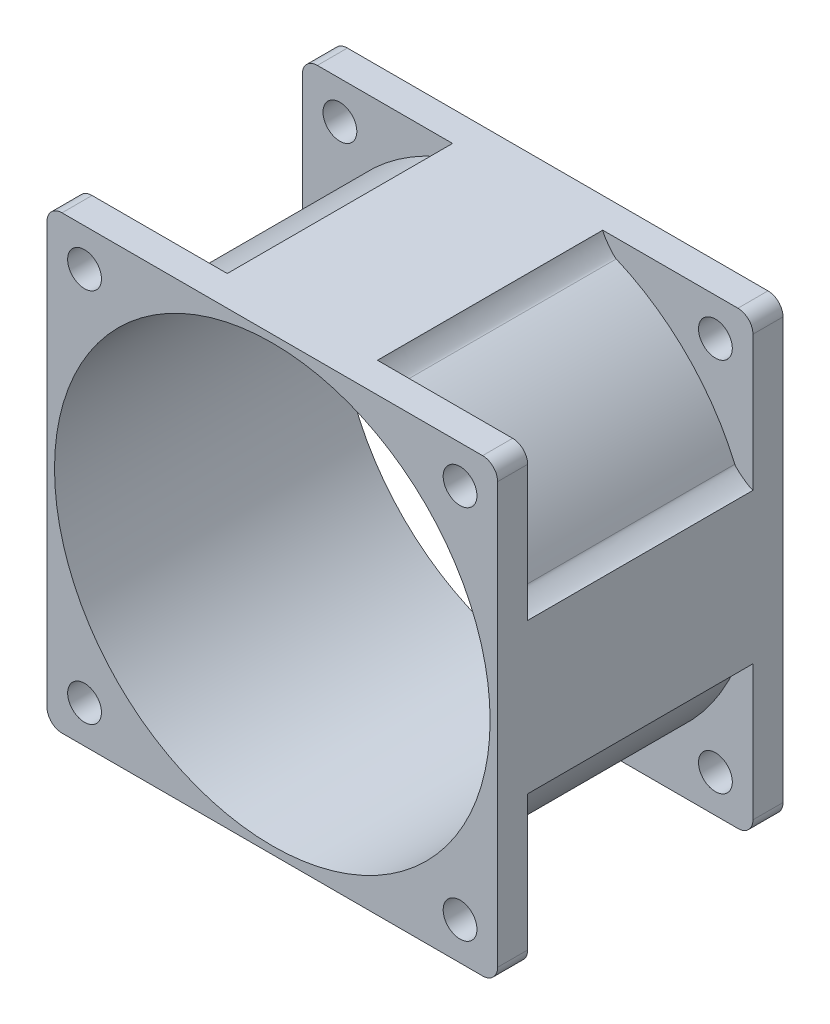
from build123d import *

# Parameters (mm, degrees)
SKETCH7_W           = 60
SKETCH7_H           = 60
BOSS_EXTRUDE1_DEPTH = 30
SKETCH8_OUTSIDE_W   = 80
SKETCH8_OUTSIDE_H   = 80
CUT_EXTRUDE1_DEPTH  = 30
FILLET3_DEPTH       = 30
SKETCH6_W           = 60
SKETCH6_H           = 60
SKETCH6_R           = 2.25
BOSS_EXTRUDE2_DEPTH = 4
BOSS_EXTRUDE3_START = 34
SKETCH9_W           = 60
SKETCH9_H           = 60
SKETCH9_R           = 2.25
BOSS_EXTRUDE3_DEPTH = 4
SKETCH11_R          = 29
CUT_EXTRUDE3_DEPTH  = 50
FILLET4_R           = 2


with BuildPart() as part:
    # Sketch7 → Boss-Extrude1 (new body)
    with BuildSketch(Plane.XY):
        Rectangle(SKETCH7_W, SKETCH7_H)
    extrude(amount=BOSS_EXTRUDE1_DEPTH)

    # Sketch8 outside → Cut-Extrude1 (cut)
    with BuildSketch(Plane.XY.offset(30)):
        Rectangle(SKETCH8_OUTSIDE_W, SKETCH8_OUTSIDE_H)
        with BuildLine():
            Line((10, 30), (-10, 30))
            Line((-10, 30), (-10, 28.284271247))
            ThreePointArc((-10, 28.284271247), (-21.213203436, 21.213203436), (-28.284271247, 10))
            Line((-28.284271247, 10), (-30, 10))
            Line((-30, 10), (-30, -10))
            Line((-30, -10), (-28.284271247, -10))
            ThreePointArc((-28.284271247, -10), (-21.213203436, -21.213203436), (-10, -28.284271247))
            Line((-10, -28.284271247), (-10, -30))
            Line((-10, -30), (10, -30))
            Line((10, -30), (10, -28.284271247))
            ThreePointArc((10, -28.284271247), (21.213203436, -21.213203436), (28.284271247, -10))
            Line((28.284271247, -10), (30, -10))
            Line((30, -10), (30, 10))
            Line((30, 10), (28.284271247, 10))
            ThreePointArc((28.284271247, 10), (21.213203436, 21.213203436), (10, 28.284271247))
            Line((10, 28.284271247), (10, 30))
        make_face(mode=Mode.SUBTRACT)
    extrude(amount=-CUT_EXTRUDE1_DEPTH, mode=Mode.SUBTRACT)

    # Fillet3: read off the stored shape, not the designer's step
    # Fillet3 outline → Fillet3 (add)
    with BuildSketch(Plane.XY):
        with BuildLine():
            ThreePointArc((-28.284271247, 10), (-27.947444484, 10.905977573), (-27.581606794, 11.800634164))
            add(Edge.make_bspline(
                [(-27.581606794, 11.800634164), (-28.267504723, 10.197485832), (-30, 10)],
                knots=[0, 0, 0, 1, 1, 1], degree=2, weights=[1, 0.259369866, 1]))
            Line((-30, 10), (-28.284271247, 10))
        make_face()
        with BuildLine():
            add(Edge.make_bspline(
                [(-10, 30), (-10.197485832, 28.267504723), (-11.800634164, 27.581606794)],
                knots=[0, 0, 0, 1, 1, 1], degree=2, weights=[1, 0.259369866, 1]))
            ThreePointArc((-11.800634164, 27.581606794), (-10.905977573, 27.947444484), (-10, 28.284271247))
            Line((-10, 28.284271247), (-10, 30))
        make_face()
        with BuildLine():
            Line((-28.284271247, -10), (-30, -10))
            add(Edge.make_bspline(
                [(-30, -10), (-28.267504723, -10.197485832), (-27.581606794, -11.800634164)],
                knots=[0, 0, 0, 1, 1, 1], degree=2, weights=[1, 0.259369866, 1]))
            ThreePointArc((-27.581606794, -11.800634164), (-27.947444484, -10.905977573), (-28.284271247, -10))
        make_face()
        with BuildLine():
            ThreePointArc((-10, -28.284271247), (-10.905977573, -27.947444484), (-11.800634164, -27.581606794))
            add(Edge.make_bspline(
                [(-11.800634164, -27.581606794), (-10.197485832, -28.267504723), (-10, -30)],
                knots=[0, 0, 0, 1, 1, 1], degree=2, weights=[1, 0.259369866, 1]))
            Line((-10, -30), (-10, -28.284271247))
        make_face()
        with BuildLine():
            Line((10, -28.284271247), (10, -30))
            add(Edge.make_bspline(
                [(10, -30), (10.197485832, -28.267504723), (11.800634164, -27.581606794)],
                knots=[0, 0, 0, 1, 1, 1], degree=2, weights=[1, 0.259369866, 1]))
            ThreePointArc((11.800634164, -27.581606794), (10.905977573, -27.947444484), (10, -28.284271247))
        make_face()
        with BuildLine():
            ThreePointArc((28.284271247, -10), (27.947444484, -10.905977573), (27.581606794, -11.800634164))
            add(Edge.make_bspline(
                [(27.581606794, -11.800634164), (28.267504723, -10.197485832), (30, -10)],
                knots=[0, 0, 0, 1, 1, 1], degree=2, weights=[1, 0.259369866, 1]))
            Line((30, -10), (28.284271247, -10))
        make_face()
        with BuildLine():
            Line((28.284271247, 10), (30, 10))
            add(Edge.make_bspline(
                [(30, 10), (28.267504723, 10.197485832), (27.581606794, 11.800634164)],
                knots=[0, 0, 0, 1, 1, 1], degree=2, weights=[1, 0.259369866, 1]))
            ThreePointArc((27.581606794, 11.800634164), (27.947444484, 10.905977573), (28.284271247, 10))
        make_face()
        with BuildLine():
            ThreePointArc((10, 28.284271247), (10.905977573, 27.947444484), (11.800634164, 27.581606794))
            add(Edge.make_bspline(
                [(11.800634164, 27.581606794), (10.197485832, 28.267504723), (10, 30)],
                knots=[0, 0, 0, 1, 1, 1], degree=2, weights=[1, 0.259369866, 1]))
            Line((10, 30), (10, 28.284271247))
        make_face()
    extrude(amount=FILLET3_DEPTH)

    # Sketch6 → Boss-Extrude2 (add)
    with BuildSketch(Plane.XY):
        Rectangle(SKETCH6_W, SKETCH6_H)
        with Locations((25, 25)):
            Circle(SKETCH6_R, mode=Mode.SUBTRACT)
        with Locations(Location((-25, 25, 0), (0, 0, 180))):
            Circle(SKETCH6_R, mode=Mode.SUBTRACT)
        with Locations((-25, -25)):
            Circle(SKETCH6_R, mode=Mode.SUBTRACT)
        with Locations(Location((25, -25, 0), (0, 0, 180))):
            Circle(SKETCH6_R, mode=Mode.SUBTRACT)
    extrude(amount=-BOSS_EXTRUDE2_DEPTH)

    # Sketch9 → Boss-Extrude3 (add)
    with BuildSketch(Plane.XY.offset(BOSS_EXTRUDE3_START)):
        Rectangle(SKETCH9_W, SKETCH9_H)
        with Locations((25, 25)):
            Circle(SKETCH9_R, mode=Mode.SUBTRACT)
        with Locations(Location((-25, 25, 0), (0, 0, 180))):
            Circle(SKETCH9_R, mode=Mode.SUBTRACT)
        with Locations((-25, -25)):
            Circle(SKETCH9_R, mode=Mode.SUBTRACT)
        with Locations(Location((25, -25, 0), (0, 0, 180))):
            Circle(SKETCH9_R, mode=Mode.SUBTRACT)
    extrude(amount=-BOSS_EXTRUDE3_DEPTH)

    # Sketch11 → Cut-Extrude3 (cut)
    with BuildSketch(Plane.XY.offset(34)):
        Circle(SKETCH11_R)
    extrude(amount=-CUT_EXTRUDE3_DEPTH, mode=Mode.SUBTRACT)

    # Fillet4
    fillet4_edges = [part.edges().sort_by_distance(p)[0] for p in [
        (-30, -30, -2),
        (-30, -30, 32),
        (30, -30, 32),
        (30, -30, -2),
        (30, 30, -2),
        (30, 30, 32),
        (-30, 30, -2),
        (-30, 30, 32),
    ]]
    fillet(fillet4_edges, radius=FILLET4_R)


solid = part.part
